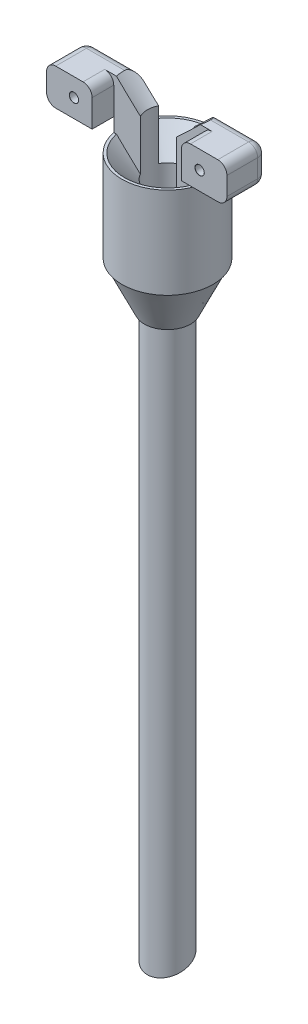
from build123d import *

# Parameters (mm, degrees)
SKETCH1_R                      = 4.425000000000001
SKETCH1_R_2                    = 1.7
BOSS_EXTRUDE1_DEPTH            = 130
CHAMFER1_SIZE                  = 8.660254038
CHAMFER1_SIZE_2                = 5
SKETCH2_R                      = 10
SKETCH2_R_2                    = 4.425000000000001
BOSS_EXTRUDE2_DEPTH            = 20
BOSS_EXTRUDE5_DEPTH            = 11
BOSS_EXTRUDE6_DEPTH            = 10
SKETCH13_W                     = 10.000000000000002
SKETCH13_H                     = 8
BOSS_EXTRUDE7_DEPTH            = 4.75
FILLET1_R                      = 2
FILLET1_OF_MIRROR1_R           = 2
CHAMFER4_SIZE                  = 5
CHAMFER2_SIZE                  = 5
BOSS_EXTRUDE3_START            = 10
SKETCH7_R                      = 9.75
SKETCH7_R_2                    = 4.425000000000001
BOSS_EXTRUDE3_DEPTH            = 10
CHAMFER3_SIZE2                 = 4.663076582
CHAMFER3_SIZE                  = 10
BOSS_EXTRUDE4_START            = 8
SKETCH8_R                      = 4.425000000000001
SKETCH8_R_2                    = 1.7
BOSS_EXTRUDE4_DEPTH            = 8
CUT_EXTRUDE1_DEPTH             = 8
CUT_EXTRUDE1_DEPTH_BACK        = 8
FILLET2_R                      = 2
F_2_0MM_DOWEL_HOLE1_AT_2_COUNT = 2
F_2_0MM_DOWEL_HOLE1_AT_2_PITCH = 27.595917942265427


# Some blends are built 0.0001 mm under size
with BuildPart() as part:
    # Sketch1 → Boss-Extrude1 (new body)
    with BuildSketch(Plane(origin=(0, 0, 0), x_dir=(1, 0, 0), z_dir=(0, 1, 0))):
        with Locations(Location((0, 0, 0), (0, 0, 270))):
            Circle(SKETCH1_R)
        with Locations(Location((0, 0, 0), (0, 0, 270))):
            Circle(SKETCH1_R_2, mode=Mode.SUBTRACT)
    extrude(amount=BOSS_EXTRUDE1_DEPTH)

    # Chamfer1
    # the kernel refuses this chamfer: 8.660254038, 5 mm, written as the material it takes off along each edge
    with BuildSketch(Plane(origin=(0, 130, 0), x_dir=(-1.8e-16, 0, 1), z_dir=(-1, 0, -1.8e-16))) as chamfer1_piece_1:
        Polygon((1.7, -CHAMFER1_SIZE), (1.7 + CHAMFER1_SIZE_2, 0), (1.7, 0), align=None)
    revolve(axis=Axis((0, 130, 0), (0, 1, 0)), mode=Mode.SUBTRACT)



with BuildPart() as body_2:
    # Sketch2 → Boss-Extrude2 (new body)
    with BuildSketch(Plane(origin=(0, 126.05958441278065, 0), x_dir=(1, 0, 0), z_dir=(0, 1, 0))):
        with Locations(Location((0, 0, 0), (0, 0, 270))):
            Circle(SKETCH2_R)
        with Locations(Location((0, 0, 0), (0, 0, 270))):
            Circle(SKETCH2_R_2, mode=Mode.SUBTRACT)
    extrude(amount=BOSS_EXTRUDE2_DEPTH)

    # Sketch10 → Boss-Extrude5 (add)
    with BuildSketch(Plane(origin=(0, 146.05958441278062, 0), x_dir=(1, 0, 0), z_dir=(0, 1, 0))):
        with BuildLine():
            Line((-3.9472300414341213, -1.9999999999999991), (-9.797958971132713, -1.9999999999999987))
            Line((-9.797958971132713, -1.9999999999999987), (-9.797958971132713, 1.9999999999999987))
            Line((-9.797958971132713, 1.9999999999999987), (-3.9472300414341213, 2.0000000000000004))
            ThreePointArc((-3.9472300414341213, 2.0000000000000004), (-4.425000000000002, 1.42e-15), (-3.9472300414341213, -1.9999999999999991))
        make_face()
        with BuildLine():
            Line((3.9472300414341213, 2.0000000000000004), (9.797958971132713, 1.9999999999999987))
            Line((9.797958971132713, 1.9999999999999987), (9.797958971132713, -1.9999999999999987))
            Line((9.797958971132713, -1.9999999999999987), (3.9472300414341213, -1.9999999999999991))
            ThreePointArc((3.9472300414341213, -1.9999999999999991), (4.425000000000002, 4.9e-16), (3.9472300414341213, 2.0000000000000004))
        make_face()
    boss_extrude5 = extrude(amount=BOSS_EXTRUDE5_DEPTH)

    # Sketch11 → Boss-Extrude6 (add)
    with BuildSketch(Plane(origin=(9.797958971132713, 0, 0), x_dir=(0, 0, -1), z_dir=(1, 0, 0))):
        Polygon((-2.0000000000000004, 157.05958441278065), (2.0000000000000004, 157.05958441278065), (2.0000000000000013, 149.05958441278065), (-1.9999999999999996, 149.05958441278065), align=None)
    boss_extrude6 = extrude(amount=BOSS_EXTRUDE6_DEPTH)

    # Sketch13 → Boss-Extrude7 (add)
    with BuildSketch(Plane.XY.offset(1.9999999999999996)):
        with Locations((14.797958971132715, 153.05958441278065)):
            Rectangle(SKETCH13_W, SKETCH13_H)
    boss_extrude7 = extrude(amount=BOSS_EXTRUDE7_DEPTH)

    # Fillet1
    fillet1_edges = [body_2.edges().sort_by_distance(p)[0] for p in [
        (19.797958971132715, 149.05958441278065, 2.374999999999999),
        (19.797958971132715, 157.05958441278065, 2.375),
        (9.797958971132713, 157.05958441278065, 4.375),
    ]]
    fillet(fillet1_edges, radius=FILLET1_R)

    # Mirror1: Boss-Extrude5, Boss-Extrude6, Boss-Extrude7 across plane
    add(boss_extrude5.mirror(Plane(origin=(0, 0, 0), x_dir=(0, 0, 1), z_dir=(1, 0, 0))))
    add(boss_extrude6.mirror(Plane(origin=(0, 0, 0), x_dir=(0, 0, 1), z_dir=(1, 0, 0))))
    add(boss_extrude7.mirror(Plane(origin=(0, 0, 0), x_dir=(0, 0, 1), z_dir=(1, 0, 0))))

    # Fillet1 of Mirror1
    fillet1_of_mirror1_edges = [body_2.edges().sort_by_distance(p)[0] for p in [
        (-19.797958971132715, 149.05958441278065, 2.374999999999999),
        (-19.797958971132715, 157.05958441278065, 2.375),
        (-9.797958971132713, 157.05958441278065, 4.375),
    ]]
    fillet(fillet1_of_mirror1_edges, radius=FILLET1_OF_MIRROR1_R)

    # Chamfer4
    chamfer4_edges = [body_2.edges().sort_by_distance(p)[0] for p in [
        (-4.425000000000001, 157.05958441278062, -8.9e-16),
        (4.425000000000001, 157.05958441278062, -4.4e-16),
    ]]
    chamfer(chamfer4_edges, length=CHAMFER4_SIZE)

    # Chamfer2
    # the kernel refuses this chamfer: 5 mm, written as the material it takes off along each edge
    with BuildSketch(Plane(origin=(0, 146.05958441278065, 0), x_dir=(-1.8e-16, 0, 1), z_dir=(-1, 0, -1.8e-16))) as chamfer2_piece_1_section:
        Polygon((4.425000000000001 + CHAMFER2_SIZE, 0), (4.425000000000001, -CHAMFER2_SIZE), (4.425000000000001, 0), align=None)
    chamfer2_piece_1 = revolve(axis=Axis((0, 146.05958441278065, 0), (0, 1, 0)), revolution_arc=229.65559156034735, mode=Mode.PRIVATE)
    chamfer2_piece_1 = split(chamfer2_piece_1, bisect_by=Plane(origin=(3.4962989060628606, 144.5390563337766, 1.9999999999999991), z_dir=(8e-17, 0, 1)), keep=Keep.TOP, mode=Mode.PRIVATE)
    add(chamfer2_piece_1, mode=Mode.SUBTRACT)
    with BuildSketch(Plane(origin=(0, 146.05958441278065, 0), x_dir=(-1.8e-16, 0, 1), z_dir=(-1, 0, -1.8e-16))) as chamfer2_piece_2_section:
        Polygon((4.425000000000001 + CHAMFER2_SIZE, 0), (4.425000000000001, -CHAMFER2_SIZE), (4.425000000000001, 0), align=None)
    chamfer2_piece_2 = revolve(axis=Axis((0, 146.05958441278065, 0), (0, 1, 0)), revolution_arc=229.65559156034735, mode=Mode.PRIVATE)
    chamfer2_piece_2 = split(chamfer2_piece_2, bisect_by=Plane(origin=(0.9948048927279718, 144.5258061794418, -2.0000000000000013), z_dir=(3e-16, 0, -1)), keep=Keep.TOP, mode=Mode.PRIVATE)
    add(chamfer2_piece_2, mode=Mode.SUBTRACT)
    with BuildSketch(Plane(origin=(0, 146.05958441278065, 0), x_dir=(0.00314158748587874, 0, 0.9999950652018582), z_dir=(-0.9999950652018582, 0, 0.00314158748587874))) as chamfer2_piece_3_section:
        Polygon((4.425000000000001, -CHAMFER2_SIZE), (4.425000000000001 + CHAMFER2_SIZE, 0), (4.425000000000001, 0), align=None)
    chamfer2_piece_3 = revolve(axis=Axis((0, 146.05958441278065, 0), (0, 1, 0)), revolution_arc=359.64000000000004, mode=Mode.PRIVATE)
    chamfer2_piece_3 = split(chamfer2_piece_3, bisect_by=Plane(origin=(3.5051865740381585, 144.53913826571085, 1.9999999999999998), z_dir=(-8e-17, 0, 1)), keep=Keep.TOP, mode=Mode.PRIVATE)
    add(chamfer2_piece_3, mode=Mode.SUBTRACT)
    with BuildSketch(Plane(origin=(0, 146.05958441278065, 0), x_dir=(0.00314158748587874, 0, 0.9999950652018582), z_dir=(-0.9999950652018582, 0, 0.00314158748587874))) as chamfer2_piece_4_section:
        Polygon((4.425000000000001, -CHAMFER2_SIZE), (4.425000000000001 + CHAMFER2_SIZE, 0), (4.425000000000001, 0), align=None)
    chamfer2_piece_4 = revolve(axis=Axis((0, 146.05958441278065, 0), (0, 1, 0)), revolution_arc=359.64000000000004, mode=Mode.PRIVATE)
    chamfer2_piece_4 = split(chamfer2_piece_4, bisect_by=Plane(origin=(-1.19549e-12, 144.53905633375842, -2.0000000000000018), z_dir=(-3e-16, 0, -1)), keep=Keep.TOP, mode=Mode.PRIVATE)
    add(chamfer2_piece_4, mode=Mode.SUBTRACT)
    with BuildSketch(Plane(origin=(0, 146.05958441278065, 0), x_dir=(0.762166791053464, 0, -0.6473807091775792), z_dir=(0.6473807091775792, 0, 0.762166791053464))) as chamfer2_piece_5_section:
        Polygon((4.425000000000001 + CHAMFER2_SIZE, 0), (4.425000000000001, -CHAMFER2_SIZE), (4.425000000000001, 0), align=None)
    chamfer2_piece_5 = revolve(axis=Axis((0, 146.05958441278065, 0), (0, 1, 0)), revolution_arc=229.6555915603473, mode=Mode.PRIVATE)
    chamfer2_piece_5 = split(chamfer2_piece_5, bisect_by=Plane(origin=(-0.9948048927279931, 144.52580617944176, -2.0000000000000013), z_dir=(-3e-16, 0, -1)), keep=Keep.TOP, mode=Mode.PRIVATE)
    add(chamfer2_piece_5, mode=Mode.SUBTRACT)
    with BuildSketch(Plane(origin=(0, 146.05958441278065, 0), x_dir=(0.762166791053464, 0, -0.6473807091775792), z_dir=(0.6473807091775792, 0, 0.762166791053464))) as chamfer2_piece_6_section:
        Polygon((4.425000000000001 + CHAMFER2_SIZE, 0), (4.425000000000001, -CHAMFER2_SIZE), (4.425000000000001, 0), align=None)
    chamfer2_piece_6 = revolve(axis=Axis((0, 146.05958441278065, 0), (0, 1, 0)), revolution_arc=229.6555915603473, mode=Mode.PRIVATE)
    chamfer2_piece_6 = split(chamfer2_piece_6, bisect_by=Plane(origin=(-3.496298906062748, 144.53905633377667, 1.9999999999999991), z_dir=(-8e-17, 0, 1)), keep=Keep.TOP, mode=Mode.PRIVATE)
    add(chamfer2_piece_6, mode=Mode.SUBTRACT)


with BuildPart() as part_1:
    add(part.part)

    add(body_2.part)  # Boss-Extrude3 merges body 2
    # Sketch7 → Boss-Extrude3 (add)
    with BuildSketch(Plane.XZ.offset(-126.05958441278065).offset(BOSS_EXTRUDE3_START)):
        with Locations(Location((0, 0, 0), (0, 0, 270))):
            Circle(SKETCH7_R)
        with Locations(Location((0, 0, 0), (0, 0, 270))):
            Circle(SKETCH7_R_2, mode=Mode.SUBTRACT)
    extrude(amount=-BOSS_EXTRUDE3_DEPTH)

    # Chamfer3
    chamfer3_edges = [part_1.edges().sort_by_distance(p)[0] for p in [
        (2.99e-15, 116.05958441278065, 9.75),
    ]]
    chamfer3_side = [part_1.faces().sort_by_distance(p)[0] for p in [
        (2.99e-15, 116.15284594441165, 9.75),
    ]]
    chamfer(chamfer3_edges, length=CHAMFER3_SIZE - 0.0001, length2=CHAMFER3_SIZE2 - 0.0001, reference=chamfer3_side[0])  # a hair under: the kernel refuses the full size

    # Sketch8 → Boss-Extrude4 (add)
    with BuildSketch(Plane.XZ.offset(BOSS_EXTRUDE4_START)):
        with Locations(Location((0, 0, 0), (0, 0, 270))):
            Circle(SKETCH8_R)
        with Locations(Location((0, 0, 0), (0, 0, 270))):
            Circle(SKETCH8_R_2, mode=Mode.SUBTRACT)
    extrude(amount=-BOSS_EXTRUDE4_DEPTH)

    # Sketch9 → Cut-Extrude1 (cut, two sides: drawn at the far end of the back side and taken through both)
    with BuildSketch(Plane(origin=(0, 0, 0), x_dir=(0, 0, -1), z_dir=(1, 0, 0)).offset(-CUT_EXTRUDE1_DEPTH_BACK)):
        Polygon((-4.425000000000001, -8.000000000000007), (4.425000000000001, -5.000000000000007), (4.425000000000001, -8.000000000000007), align=None)
    extrude(amount=CUT_EXTRUDE1_DEPTH + CUT_EXTRUDE1_DEPTH_BACK, mode=Mode.SUBTRACT)

    # Fillet2
    fillet2_edges = [part_1.edges().sort_by_distance(p)[0] for p in [
        (13.797958971132715, 149.05958441278065, -2.0000000000000013),
        (19.21217253350581, 149.64537085040755, -1.9999999999999964),
        (19.797958971132715, 153.05958441278062, -2.000000000000001),
        (19.21217253350581, 156.47379797515373, -1.9999999999999964),
        (-13.797958971132715, 149.05958441278065, -2.0000000000000013),
        (-19.21217253350581, 149.64537085040755, -1.9999999999999964),
        (-19.797958971132715, 153.05958441278062, -2.000000000000001),
        (-19.21217253350581, 156.47379797515373, -1.9999999999999964),
        (13.504156599424196, 157.05958441278062, -2),
        (-13.504156599424196, 157.05958441278065, -2.0000000000000004),
    ]]
    fillet(fillet2_edges, radius=FILLET2_R)

    # Sketch17 → Ø2.0mm Dowel Hole1 (revolve, cut)
    with BuildSketch(Plane(origin=(-13.797958971132712, 153.05958441278065, -1.9999999999999978), x_dir=(0, 1, 0), z_dir=(1, 0, -3e-16))):
        Polygon((0, 0), (-2.14e-15, 8.749999999999998), (1.0249999999999977, 8.749999999999998), (0.9999999999999983, 8.724999999999996), (0.9999999999999993, 0.02500000000000072), (1.025, 0), align=None)
    f_2_0mm_dowel_hole1 = revolve(axis=Axis((-13.797958971132713, 153.05958441278065, -8.349999999999989), (3e-16, 0, 1)), mode=Mode.SUBTRACT)

    # Ø2.0mm Dowel Hole1 at 2: Ø2.0mm Dowel Hole1 ×2
    with Locations(*[(i * F_2_0MM_DOWEL_HOLE1_AT_2_PITCH, 0, 0) for i in range(1, F_2_0MM_DOWEL_HOLE1_AT_2_COUNT)]):
        add(f_2_0mm_dowel_hole1, mode=Mode.SUBTRACT)


solid = part_1.part
